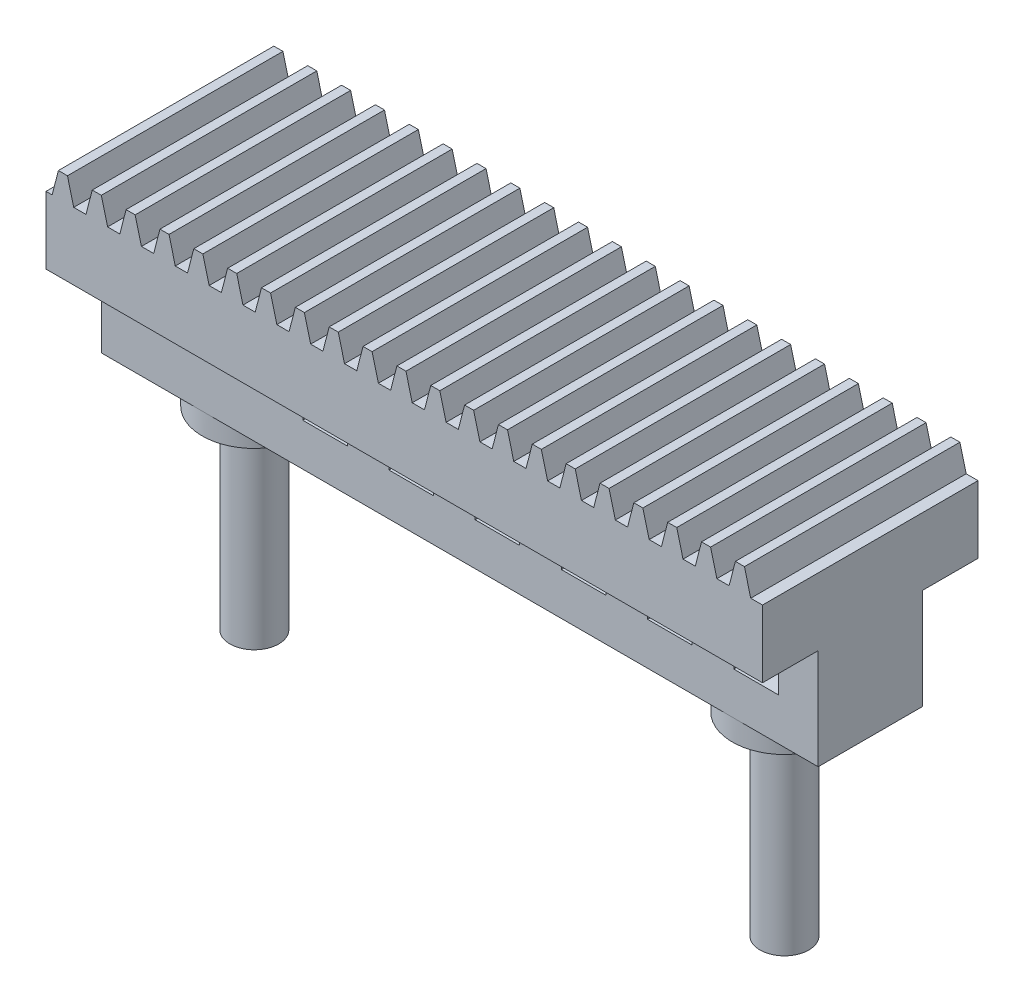
from build123d import *

# Parameters (mm, degrees)
BLANKSKE_W                 = 100
BLANKSKE_H                 = 12.75
BLANK_DEPTH                = 20
TOOTHCUTSIM_DEPTH          = 103.77432802
TEETHCUTS_COUNT            = 23
TEETHCUTS_PITCH            = 4.712388975
SALIENTE_EXTRUIR1_DEPTH    = 10
CORTAR_EXTRUIR1_DEPTH      = 103.77432802
CORTAR_EXTRUIR1_DEPTH_BACK = 0.25
CROQUIS12_W                = 30
CROQUIS12_H                = 10.100558753
CROQUIS13_W                = 99.75
CROQUIS13_H                = 14.5
SALIENTE_EXTRUIR6_DEPTH    = 14
CROQUIS14_R                = 7.25
CROQUIS14_R_2              = 3.4
SALIENTE_EXTRUIR7_DEPTH    = 3
CROQUIS15_R                = 3.4
SALIENTE_EXTRUIR8_DEPTH    = 30
CORTAR_EXTRUIR2_DEPTH      = 112.270503729
CORTAR_EXTRUIR2_DEPTH_BACK = 112.270503729
CROQUIS16_W                = 6.2
CROQUIS16_H                = 3.2


with BuildPart() as part:
    # BlankSke → Blank (new body)
    with BuildSketch(Plane.XY):
        with Locations((50, 6.375)):
            Rectangle(BLANKSKE_W, BLANKSKE_H)
    extrude(amount=-BLANK_DEPTH)

    # TooCutSkeSim → ToothCutSim (cut, through all)
    with BuildSketch(Plane.XY):
        Polygon((0.852189273, 9.375), (-0.852189273, 9.375), (-1.731592507, 12.7754), (1.731592507, 12.7754), align=None)
    toothcutsim = extrude(amount=-TOOTHCUTSIM_DEPTH, mode=Mode.SUBTRACT)

    # TeethCuts: ToothCutSim ×23
    with Locations(*[(i * TEETHCUTS_PITCH, 0, 0) for i in range(1, TEETHCUTS_COUNT)]):
        add(toothcutsim, mode=Mode.SUBTRACT)

    # Croquis1 → Saliente-Extruir1 (add)
    with BuildSketch(Plane.XY):
        Polygon((99.812357748, 9.375), (98.107979202, 9.375), (97.235144855, 12.75), (95.97280312, 12.75), (95.099968773, 9.375), (93.395590227, 9.375), (92.52275588, 12.75), (91.260414145, 12.75), (90.387579798, 9.375), (88.683201252, 9.375), (87.810366905, 12.75), (86.54802517, 12.75), (85.675190823, 9.375), (83.970812277, 9.375), (83.09797793, 12.75), (81.835636195, 12.75), (80.962801848, 9.375), (79.258423302, 9.375), (78.385588955, 12.75), (77.12324722, 12.75), (76.250412873, 9.375), (74.546034327, 9.375), (73.67319998, 12.75), (72.410858245, 12.75), (71.538023898, 9.375), (69.833645352, 9.375), (68.960811005, 12.75), (67.69846927, 12.75), (66.825634923, 9.375), (65.121256377, 9.375), (64.24842203, 12.75), (62.986080295, 12.75), (62.113245948, 9.375), (60.408867402, 9.375), (59.536033055, 12.75), (58.27369132, 12.75), (57.400856973, 9.375), (55.696478427, 9.375), (54.82364408, 12.75), (53.561302345, 12.75), (52.688467998, 9.375), (50.984089452, 9.375), (50.111255105, 12.75), (48.84891337, 12.75), (47.976079023, 9.375), (46.271700477, 9.375), (45.39886613, 12.75), (44.136524395, 12.75), (43.263690048, 9.375), (41.559311502, 9.375), (40.686477155, 12.75), (39.42413542, 12.75), (38.551301073, 9.375), (36.846922527, 9.375), (35.97408818, 12.75), (34.711746445, 12.75), (33.838912098, 9.375), (32.134533552, 9.375), (31.261699205, 12.75), (29.99935747, 12.75), (29.126523123, 9.375), (27.422144577, 9.375), (26.54931023, 12.75), (25.286968495, 12.75), (24.414134148, 9.375), (22.709755602, 9.375), (21.836921255, 12.75), (20.57457952, 12.75), (19.701745173, 9.375), (17.997366627, 9.375), (17.12453228, 12.75), (15.862190545, 12.75), (14.989356198, 9.375), (13.284977652, 9.375), (12.412143305, 12.75), (11.14980157, 12.75), (10.276967223, 9.375), (8.572588677, 9.375), (7.69975433, 12.75), (6.437412595, 12.75), (5.564578248, 9.375), (3.860199702, 9.375), (2.987365355, 12.75), (1.72502362, 12.75), (0.852189273, 9.375), (0, 9.375), (0, 0), (100, 0), (100, 10.100558753), align=None)
    extrude(amount=SALIENTE_EXTRUIR1_DEPTH)

    # Croquis12 → Cortar-Extruir1 (cut, two sides: drawn at the far end of the back side and taken through both)
    with BuildSketch(Plane(origin=(100, 0, 0), x_dir=(0, 0, -1), z_dir=(1, 0, 0)).offset(-CORTAR_EXTRUIR1_DEPTH_BACK)):
        with Locations((5, 5.050279377)):
            Rectangle(CROQUIS12_W, CROQUIS12_H)
    extrude(amount=CORTAR_EXTRUIR1_DEPTH + CORTAR_EXTRUIR1_DEPTH_BACK, mode=Mode.SUBTRACT)

    # Croquis13 → Saliente-Extruir6 (add)
    with BuildSketch(Plane.XZ):
        with Locations((49.875, -5)):
            Rectangle(CROQUIS13_W, CROQUIS13_H)
    extrude(amount=SALIENTE_EXTRUIR6_DEPTH)

    # Croquis14 → Saliente-Extruir7 (add)
    # profile 1 of 2: a face of its own
    with BuildSketch(Plane.XZ.offset(14)):
        with Locations((14, -5)):
            Circle(CROQUIS14_R)
        with Locations((14, -5)):
            Circle(CROQUIS14_R_2, mode=Mode.SUBTRACT)
    # profile 2 of 2: a face of its own
    with BuildSketch(Plane.XZ.offset(14)):
        with Locations((87.8, -5)):
            Circle(CROQUIS14_R)
        with Locations((87.8, -5)):
            Circle(CROQUIS14_R_2, mode=Mode.SUBTRACT)
    extrude(amount=SALIENTE_EXTRUIR7_DEPTH)

    # Croquis15 → Saliente-Extruir8 (add)
    with BuildSketch(Plane.XZ.offset(14)):
        with Locations((87.8, -5)):
            Circle(CROQUIS15_R)
        with Locations((14, -5)):
            Circle(CROQUIS15_R)
    extrude(amount=SALIENTE_EXTRUIR8_DEPTH)

    # Croquis16 → Cortar-Extruir2 (cut, two sides: drawn at the far end of the back side and taken through both)
    with BuildSketch(Plane.XY.offset(2.25).offset(-CORTAR_EXTRUIR2_DEPTH_BACK)):
        with Locations((43.1, -6.5)):
            Rectangle(CROQUIS16_W, CROQUIS16_H)
        with Locations((31.1, -6.5)):
            Rectangle(CROQUIS16_W, CROQUIS16_H)
        with Locations((55.1, -6.5)):
            Rectangle(CROQUIS16_W, CROQUIS16_H)
        with Locations((67.1, -6.5)):
            Rectangle(CROQUIS16_W, CROQUIS16_H)
        with Locations((79.1, -6.5)):
            Rectangle(CROQUIS16_W, CROQUIS16_H)
        with Locations((91.1, -6.5)):
            Rectangle(CROQUIS16_W, CROQUIS16_H)
    extrude(amount=CORTAR_EXTRUIR2_DEPTH + CORTAR_EXTRUIR2_DEPTH_BACK, mode=Mode.SUBTRACT)


solid = part.part
